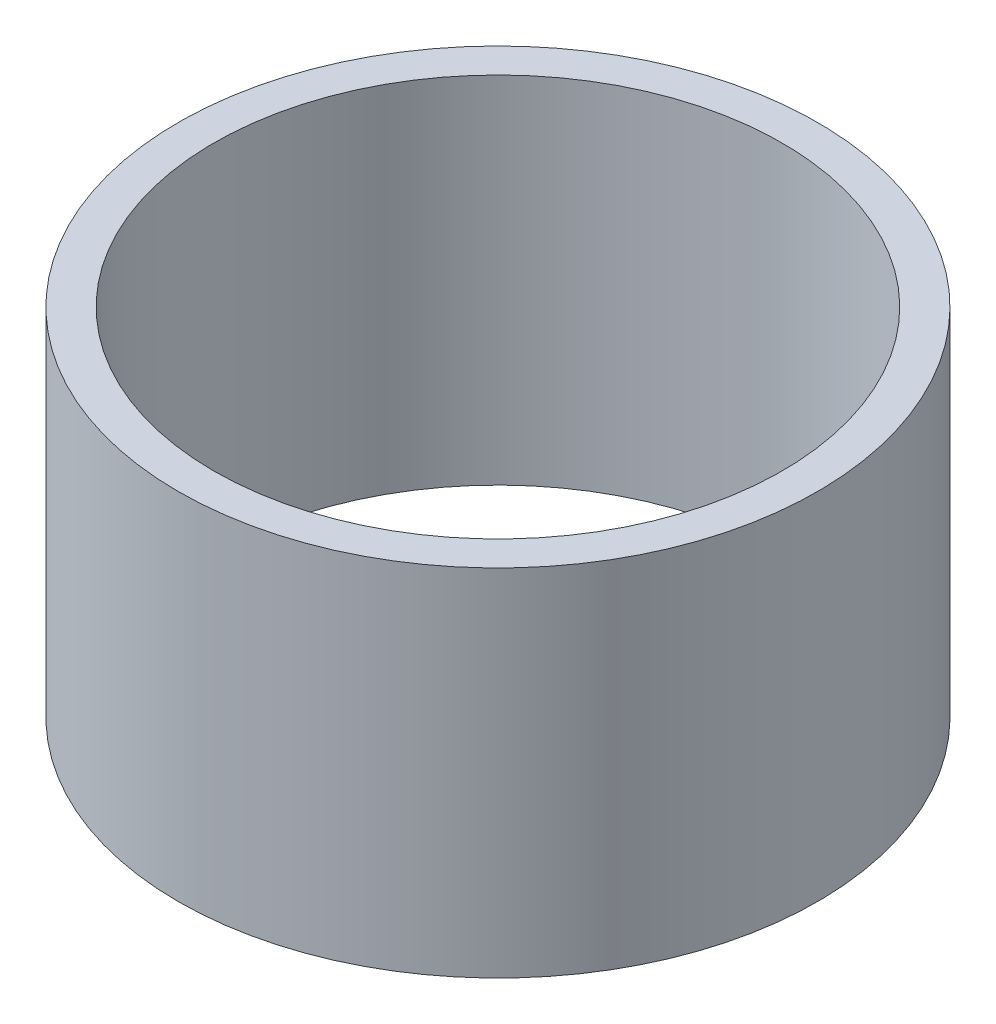
from build123d import *

# Parameters (mm, degrees)
SKETCH1_R           = 57.15
SKETCH1_R_2         = 50.8
BOSS_EXTRUDE1_DEPTH = 63.5


with BuildPart() as part:
    # Sketch1 → Boss-Extrude1 (new body)
    with BuildSketch(Plane(origin=(0, 0, 0), x_dir=(1, 0, 0), z_dir=(0, 1, 0))):
        Circle(SKETCH1_R)
        Circle(SKETCH1_R_2, mode=Mode.SUBTRACT)
    extrude(amount=BOSS_EXTRUDE1_DEPTH)


solid = part.part
